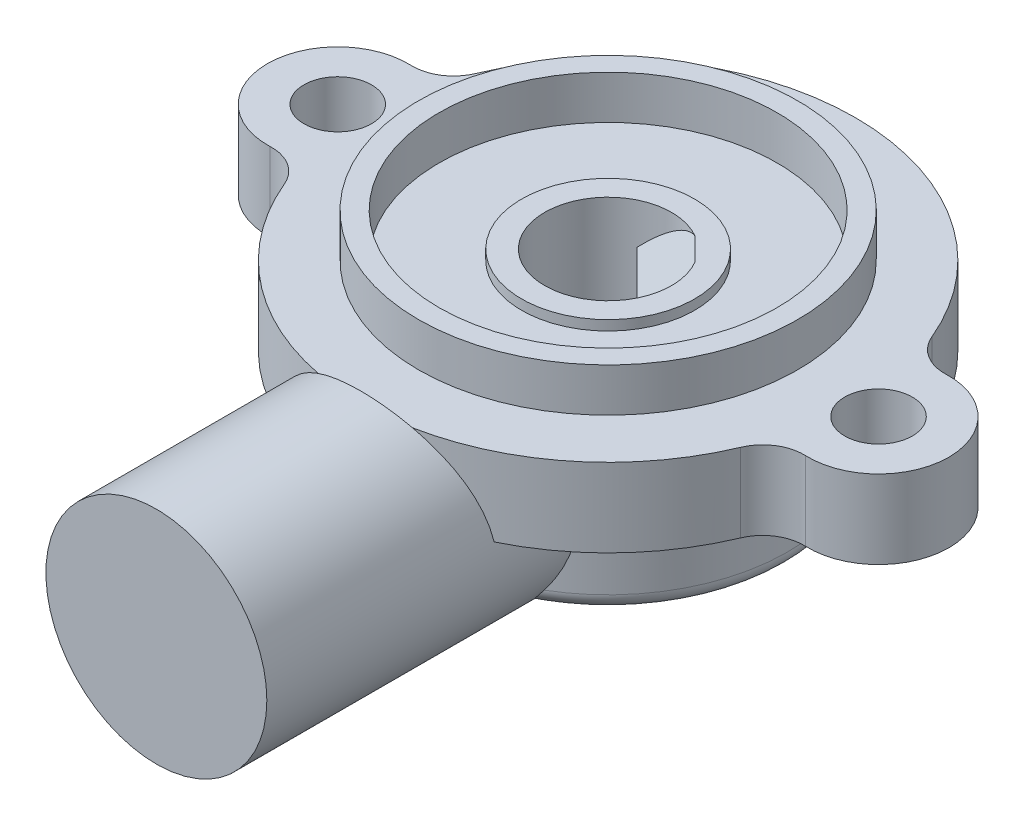
from build123d import *

# Parameters (mm, degrees)
SKETCH3_R           = 2.6035
BOSS_EXTRUDE1_DEPTH = 9.398
CUT_EXTRUDE1_START  = -3.3528
SKETCH4_R           = 14.605
SKETCH4_R_2         = 2.6035
SKETCH4_R_3         = 13.0175
CUT_EXTRUDE1_DEPTH  = 3.3528
SKETCH5_R           = 13.843
BOSS_EXTRUDE2_DEPTH = 7.747
SKETCH6_R           = 8.4455
BOSS_EXTRUDE3_DEPTH = 1.905
SKETCH7_R           = 8.509
BOSS_EXTRUDE4_DEPTH = 34.798
CUT_EXTRUDE2_DEPTH  = 47.503968347
FILLET1_R           = 3.175
CHAMFER1_SIZE       = 1.905
SKETCH9_R           = 6.6675
BOSS_EXTRUDE5_DEPTH = 0.762
CUT_EXTRUDE3_DEPTH  = 11.43
CHAMFER2_SIZE       = 3.175
FILLET2_R           = 1.27


with BuildPart() as part:
    # Sketch3 → Boss-Extrude1 (new body)
    with BuildSketch(Plane(origin=(0, 0, 0), x_dir=(1, 0, 0), z_dir=(0, 1, 0))):
        with BuildLine():
            ThreePointArc((18.41992125, -4.85890946), (26.2509, 0), (18.41992125, 4.85890946))
            ThreePointArc((18.41992125, 4.85890946), (0, 19.05), (-18.41992125, 4.85890946))
            ThreePointArc((-18.41992125, 4.85890946), (-26.2509, 0), (-18.41992125, -4.85890946))
            ThreePointArc((-18.41992125, -4.85890946), (0, -19.05), (18.41992125, -4.85890946))
        make_face()
        with Locations(Location((-20.828, 0, 0), (0, 0, 270))):
            Circle(SKETCH3_R, mode=Mode.SUBTRACT)
        with Locations(Location((20.828, 0, 0), (0, 0, 270))):
            Circle(SKETCH3_R, mode=Mode.SUBTRACT)
    extrude(amount=BOSS_EXTRUDE1_DEPTH)

    # Sketch4 → Cut-Extrude1 (cut)
    # profile 1 of 2: a face of its own
    with BuildSketch(Plane(origin=(0, 9.398, 0), x_dir=(1, 0, 0), z_dir=(0, 1, 0)).offset(CUT_EXTRUDE1_START)):
        with BuildLine():
            ThreePointArc((-18.41992125, 4.85890946), (-26.2509, 0), (-18.41992125, -4.85890946))
            ThreePointArc((-18.41992125, -4.85890946), (0, -19.05), (18.41992125, -4.85890946))
            ThreePointArc((18.41992125, -4.85890946), (26.2509, 0), (18.41992125, 4.85890946))
            ThreePointArc((18.41992125, 4.85890946), (0, 19.05), (-18.41992125, 4.85890946))
        make_face()
        with Locations(Location((0, 0, 0), (0, 0, 270))):
            Circle(SKETCH4_R, mode=Mode.SUBTRACT)
        with Locations(Location((20.828, 0, 0), (0, 0, 270))):
            Circle(SKETCH4_R_2, mode=Mode.SUBTRACT)
        with Locations(Location((-20.828, 0, 0), (0, 0, 270))):
            Circle(SKETCH4_R_2, mode=Mode.SUBTRACT)
    # profile 2 of 2: a face of its own
    with BuildSketch(Plane(origin=(0, 9.398, 0), x_dir=(1, 0, 0), z_dir=(0, 1, 0)).offset(CUT_EXTRUDE1_START)):
        with Locations(Location((0, 0, 0), (0, 0, 270))):
            Circle(SKETCH4_R_3)
    extrude(amount=CUT_EXTRUDE1_DEPTH, mode=Mode.SUBTRACT)

    # Sketch5 → Boss-Extrude2 (add)
    with BuildSketch(Plane.XZ):
        with Locations(Location((0, 0, 0), (0, 0, 270))):
            Circle(SKETCH5_R)
    extrude(amount=BOSS_EXTRUDE2_DEPTH)

    # Sketch6 → Boss-Extrude3 (add)
    with BuildSketch(Plane.XZ.offset(7.747)):
        with Locations(Location((0, 0, 0), (0, 0, 90))):
            Circle(SKETCH6_R)
    extrude(amount=BOSS_EXTRUDE3_DEPTH)

    # Sketch7 → Boss-Extrude4 (add)
    with BuildSketch(Plane.XY):
        with Locations(Location((0, -1.651, 0), (0, 0, 168.811944249))):
            Circle(SKETCH7_R)
    extrude(amount=BOSS_EXTRUDE4_DEPTH)

    # Sketch8 → Cut-Extrude2 (cut, through all)
    with BuildSketch(Plane(origin=(0, 6.0452, 0), x_dir=(1, 0, 0), z_dir=(0, 1, 0))):
        with BuildLine():
            Line((-3.629268047, 0), (-3.629268047, -12.501348715))
            ThreePointArc((-3.629268047, -12.501348715), (0, -13.0175), (3.629268047, -12.501348715))
            Line((3.629268047, -12.501348715), (3.629268047, 0))
            Line((3.629268047, 0), (-3.629268047, 0))
        make_face()
        with BuildLine():
            ThreePointArc((-3.629268047, -18.70109391), (0, -19.05), (3.629268047, -18.70109391))
            Line((3.629268047, -18.70109391), (3.629268047, -14.146887942))
            ThreePointArc((3.629268047, -14.146887942), (0, -14.605), (-3.629268047, -14.146887942))
            Line((-3.629268047, -14.146887942), (-3.629268047, -18.70109391))
        make_face()
    extrude(amount=CUT_EXTRUDE2_DEPTH, mode=Mode.SUBTRACT)

    # Fillet1
    fillet1_edges = [part.edges().sort_by_distance(p)[0] for p in [
        (-18.41992125, 3.0226, 4.85890946),
        (-18.41992125, 3.0226, -4.85890946),
        (18.41992125, 3.0226, -4.85890946),
        (18.41992125, 3.0226, 4.85890946),
    ]]
    fillet(fillet1_edges, radius=FILLET1_R)

    # Chamfer1
    chamfer1_edges = [part.edges().sort_by_distance(p)[0] for p in [
        (0, -9.652, -8.4455),
    ]]
    chamfer(chamfer1_edges, length=CHAMFER1_SIZE - 0.0001)  # a hair under: the kernel refuses the full size

    # Sketch9 → Boss-Extrude5 (add)
    with BuildSketch(Plane(origin=(0, 6.0452, 0), x_dir=(1, 0, 0), z_dir=(0, 1, 0))):
        with Locations(Location((0, 0, 0), (0, 0, 90))):
            Circle(SKETCH9_R)
    extrude(amount=BOSS_EXTRUDE5_DEPTH)

    # Sketch10 → Cut-Extrude3 (cut)
    with BuildSketch(Plane(origin=(0, 6.8072, 0), x_dir=(1, 0, 0), z_dir=(0, 1, 0))):
        with BuildLine():
            Line((-2.171634675, 4.380777681), (4.380777681, -2.171634675))
            ThreePointArc((4.380777681, -2.171634675), (-3.457398607, -3.457398607), (-2.171634675, 4.380777681))
        make_face()
    extrude(amount=-CUT_EXTRUDE3_DEPTH, mode=Mode.SUBTRACT)

    # Chamfer2
    chamfer2_edges = [part.edges().sort_by_distance(p)[0] for p in [
        (1.104571503, 6.8072, -1.104571503),
    ]]
    chamfer(chamfer2_edges, length=CHAMFER2_SIZE)

    # Fillet2
    fillet2_edges = [part.edges().sort_by_distance(p)[0] for p in [
        (0, -7.747, -13.843),
    ]]
    fillet(fillet2_edges, radius=FILLET2_R)


solid = part.part
